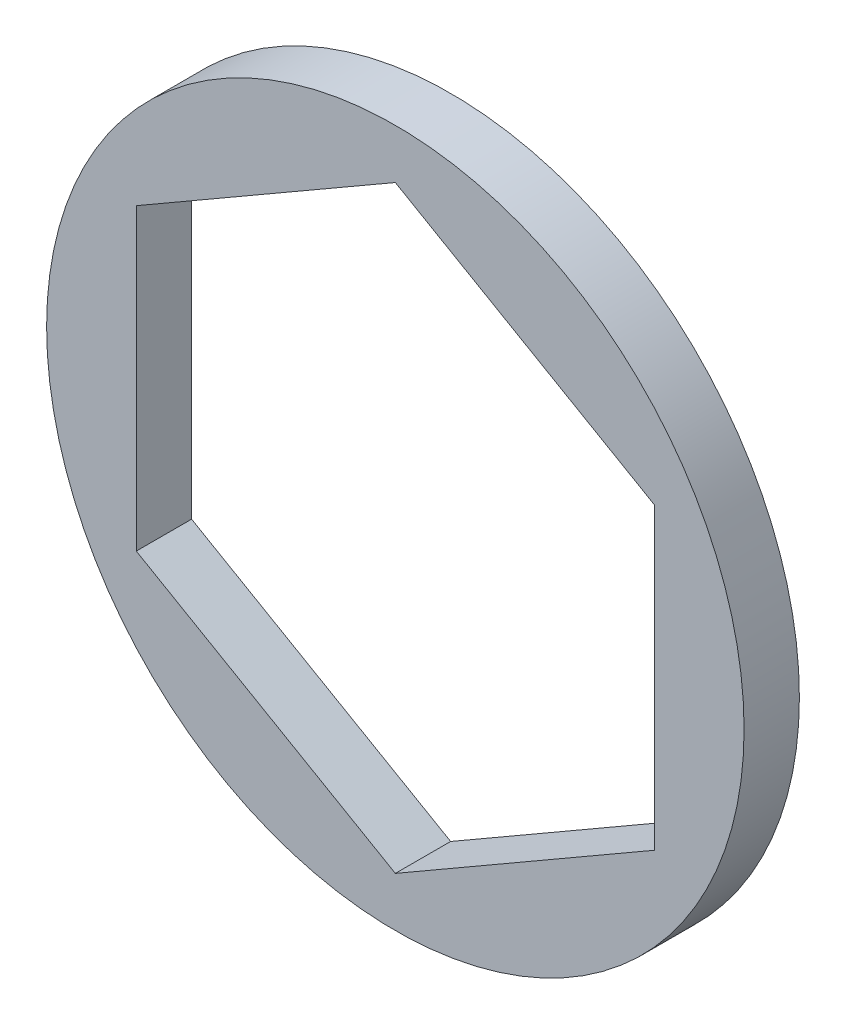
from build123d import *

# Parameters (mm, degrees)
SKETCH1_R           = 8.89
BOSS_EXTRUDE1_DEPTH = 1.4097


with BuildPart() as part:
    # Sketch1 → Boss-Extrude1 (new body)
    with BuildSketch(Plane.XY):
        Circle(SKETCH1_R)
        Polygon((6.604, 3.812821178), (0, 7.625642355), (-6.604, 3.812821178), (-6.604, -3.812821178), (0, -7.625642355), (6.604, -3.812821178), align=None, mode=Mode.SUBTRACT)
    extrude(amount=BOSS_EXTRUDE1_DEPTH)


solid = part.part
